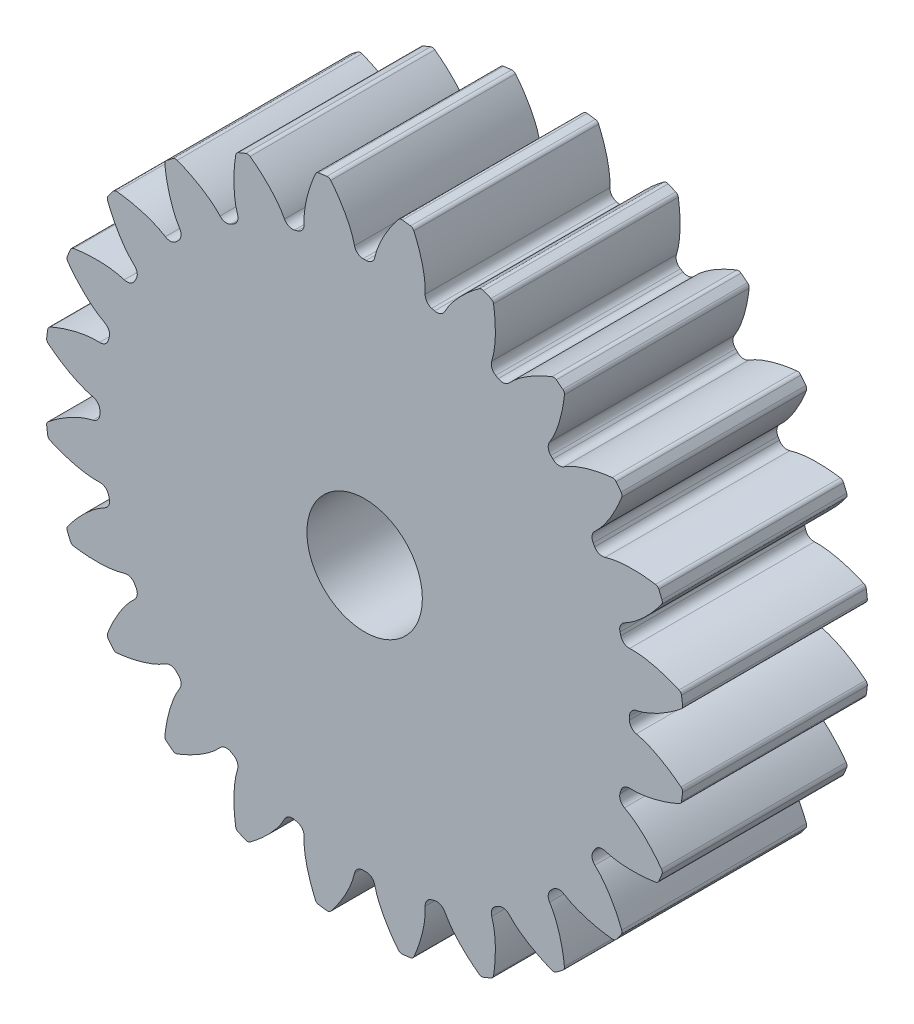
from build123d import *

# Parameters (mm, degrees)
SKETCH1_R                                 = 22.013333333
BOSS_EXTRUDE1_DEPTH                       = 12.7
CUT_EXTRUDE_DCLTBC_DEPTH                  = 34.622368877
FILLET_TIP_DCLTBC_R                       = 0.301120865
FILLET_ROOT_DCLTBC_R                      = 0.602241731
CIRPATTERN_DCLTBC_COUNT                   = 24
FILLET_TIP_DCLTBC_OF_CIRPATTERN_DCLTBC_R  = 0.301120865
FILLET_ROOT_DCLTBC_OF_CIRPATTERN_DCLTBC_R = 0.602241731
SKETCH8_R                                 = 3.96875
CUT_EXTRUDE5_DEPTH                        = 25.4


with BuildPart() as part:
    # Sketch1 → Boss-Extrude1 (new body)
    with BuildSketch(Plane.XY):
        Circle(SKETCH1_R)
    extrude(amount=BOSS_EXTRUDE1_DEPTH)

    # DCLTBC → Cut-Extrude-DCLTBC (cut, through all)
    with BuildSketch(Plane.XY):
        with BuildLine():
            Line((-0.65316759, 18.40458762), (-0.645618749, 18.191880631))
            ThreePointArc((-0.645618749, 18.191880631), (0, 18.203333333), (0.645618749, 18.191880631))
            Line((0.645618749, 18.191880631), (0.65316759, 18.40458762))
            add(Edge.make_bspline(
                [(0.65316759, 18.40458762), (0.653455488, 18.41041931), (0.654513176, 18.426763296), (0.657500609, 18.4576082), (0.663776304, 18.507831806), (0.673829279, 18.571642864), (0.68917972, 18.653865984), (0.710287754, 18.750357216), (0.736645624, 18.855957946), (0.76872217, 18.970315677), (0.803721487, 19.083890812), (0.841416112, 19.196668946), (0.881468461, 19.308519325), (0.932929894, 19.443377919), (0.998724669, 19.604184964), (1.081547695, 19.790715524), (1.182440671, 20.000496086), (1.292649071, 20.212244804), (1.407142048, 20.418866576), (1.529709249, 20.625480648), (1.653176589, 20.823856906), (1.788390425, 21.02752824), (1.916752528, 21.214328562), (2.068189061, 21.420811695), (2.192634463, 21.58664135), (2.327481485, 21.755498466), (2.394038027, 21.837316444), (2.428441227, 21.878974328)],
                knots=[0, 0, 0, 0, 0, 0.005376749, 0.015083688, 0.02853182, 0.04661014, 0.064854849, 0.092110526, 0.119476176, 0.146842496, 0.174208854, 0.201574956, 0.228941013, 0.256307345, 0.307035032, 0.361767352, 0.416499661, 0.471231937, 0.525964282, 0.580696616, 0.635428982, 0.690161387, 0.744893688, 0.799626082, 0.854358408, 0.909090915, 0.909090915, 0.909090915, 0.909090915, 0.909090915], degree=4))
            ThreePointArc((2.428441227, 21.878974328), (0, 22.013333333), (-2.428441227, 21.878974328))
            add(Edge.make_bspline(
                [(-0.65316759, 18.40458762), (-0.653455488, 18.41041931), (-0.654513176, 18.426763296), (-0.657500609, 18.4576082), (-0.663776304, 18.507831806), (-0.673829279, 18.571642864), (-0.68917972, 18.653865984), (-0.710287754, 18.750357216), (-0.736645624, 18.855957946), (-0.76872217, 18.970315677), (-0.803721487, 19.083890812), (-0.841416112, 19.196668946), (-0.881468461, 19.308519325), (-0.932929894, 19.443377919), (-0.998724669, 19.604184964), (-1.081547695, 19.790715524), (-1.182440671, 20.000496086), (-1.292649071, 20.212244804), (-1.407142048, 20.418866576), (-1.529709249, 20.625480648), (-1.653176589, 20.823856906), (-1.788390425, 21.02752824), (-1.916752528, 21.214328562), (-2.068189061, 21.420811695), (-2.192634463, 21.58664135), (-2.327481485, 21.755498466), (-2.394038027, 21.837316444), (-2.428441227, 21.878974328)],
                knots=[0, 0, 0, 0, 0, 0.005376749, 0.015083688, 0.02853182, 0.04661014, 0.064854849, 0.092110526, 0.119476176, 0.146842496, 0.174208854, 0.201574956, 0.228941013, 0.256307345, 0.307035032, 0.361767352, 0.416499661, 0.471231937, 0.525964282, 0.580696616, 0.635428982, 0.690161387, 0.744893688, 0.799626082, 0.854358408, 0.909090915, 0.909090915, 0.909090915, 0.909090915, 0.909090915], degree=4))
        make_face()
    cut_extrude_dcltbc = extrude(amount=CUT_EXTRUDE_DCLTBC_DEPTH, mode=Mode.SUBTRACT)

    # Fillet-Tip-DCLTBC
    fillet_tip_dcltbc_edges = [part.edges().sort_by_distance(p)[0] for p in [
        (2.428441227, 21.878974328, 6.35),
        (-2.428441227, 21.878974328, 6.35),
    ]]
    fillet(fillet_tip_dcltbc_edges, radius=FILLET_TIP_DCLTBC_R)

    # Fillet-Root-DCLTBC
    fillet_root_dcltbc_edges = [part.edges().sort_by_distance(p)[0] for p in [
        (-0.645618749, 18.191880631, 6.35),
        (0.645618749, 18.191880631, 6.35),
    ]]
    fillet(fillet_root_dcltbc_edges, radius=FILLET_ROOT_DCLTBC_R)

    # CirPattern-DCLTBC: Cut-Extrude-DCLTBC ×24 about axis
    cirpattern_dcltbc_axis = Axis((0, 0, 12.7), (0, 0, 1))
    for i in range(1, CIRPATTERN_DCLTBC_COUNT):
        add(cut_extrude_dcltbc.rotate(cirpattern_dcltbc_axis, i * 360 / CIRPATTERN_DCLTBC_COUNT), mode=Mode.SUBTRACT)

    # Fillet-Tip-DCLTBC of CirPattern-DCLTBC
    fillet_tip_dcltbc_of_cirpattern_dcltbc_edges = [part.edges().sort_by_distance(p)[0] for p in [
        (-3.317001145, 21.761993196, 6.35),
        (-8.008389342, 20.504939517, 6.35),
        (-8.83639537, 20.16196819, 6.35),
        (-13.042578958, 17.733526963, 6.35),
        (-13.753603853, 17.187938372, 6.35),
        (-17.187938372, 13.753603853, 6.35),
        (-17.733526963, 13.042578958, 6.35),
        (-20.16196819, 8.83639537, 6.35),
        (-20.504939517, 8.008389342, 6.35),
        (-21.761993196, 3.317001145, 6.35),
        (-21.878974328, 2.428441227, 6.35),
        (-21.878974328, -2.428441227, 6.35),
        (-21.761993196, -3.317001145, 6.35),
        (-20.504939517, -8.008389342, 6.35),
        (-20.16196819, -8.83639537, 6.35),
        (-17.733526963, -13.042578958, 6.35),
        (-17.187938372, -13.753603853, 6.35),
        (-13.753603853, -17.187938372, 6.35),
        (-13.042578958, -17.733526963, 6.35),
        (-8.83639537, -20.16196819, 6.35),
        (-8.008389342, -20.504939517, 6.35),
        (-3.317001145, -21.761993196, 6.35),
        (-2.428441227, -21.878974328, 6.35),
        (2.428441227, -21.878974328, 6.35),
        (3.317001145, -21.761993196, 6.35),
        (8.008389342, -20.504939517, 6.35),
        (8.83639537, -20.16196819, 6.35),
        (13.042578958, -17.733526963, 6.35),
        (13.753603853, -17.187938372, 6.35),
        (17.187938372, -13.753603853, 6.35),
        (17.733526963, -13.042578958, 6.35),
        (20.16196819, -8.83639537, 6.35),
        (20.504939517, -8.008389342, 6.35),
        (21.761993196, -3.317001145, 6.35),
        (21.878974328, -2.428441227, 6.35),
        (21.878974328, 2.428441227, 6.35),
        (21.761993196, 3.317001145, 6.35),
        (20.504939517, 8.008389342, 6.35),
        (20.16196819, 8.83639537, 6.35),
        (17.733526963, 13.042578958, 6.35),
        (17.187938372, 13.753603853, 6.35),
        (13.753603853, 17.187938372, 6.35),
        (13.042578958, 17.733526963, 6.35),
        (8.83639537, 20.16196819, 6.35),
        (8.008389342, 20.504939517, 6.35),
        (3.317001145, 21.761993196, 6.35),
    ]]
    fillet(fillet_tip_dcltbc_of_cirpattern_dcltbc_edges, radius=FILLET_TIP_DCLTBC_OF_CIRPATTERN_DCLTBC_R)

    # Fillet-Root-DCLTBC of CirPattern-DCLTBC
    fillet_root_dcltbc_of_cirpattern_dcltbc_edges = [part.edges().sort_by_distance(p)[0] for p in [
        (-5.332024997, 17.404908902, 6.35),
        (-4.08478535, 17.739105758, 6.35),
        (-9.655062553, 15.431821394, 6.35),
        (-8.536818077, 16.077440143, 6.35),
        (-13.320123552, 12.407080761, 6.35),
        (-12.407080761, 13.320123552, 6.35),
        (-16.077440143, 8.536818077, 6.35),
        (-15.431821394, 9.655062553, 6.35),
        (-17.739105758, 4.08478535, 6.35),
        (-17.404908902, 5.332024997, 6.35),
        (-18.191880631, -0.645618749, 6.35),
        (-18.191880631, 0.645618749, 6.35),
        (-17.404908902, -5.332024997, 6.35),
        (-17.739105758, -4.08478535, 6.35),
        (-15.431821394, -9.655062553, 6.35),
        (-16.077440143, -8.536818077, 6.35),
        (-12.407080761, -13.320123552, 6.35),
        (-13.320123552, -12.407080761, 6.35),
        (-8.536818077, -16.077440143, 6.35),
        (-9.655062553, -15.431821394, 6.35),
        (-4.08478535, -17.739105758, 6.35),
        (-5.332024997, -17.404908902, 6.35),
        (0.645618749, -18.191880631, 6.35),
        (-0.645618749, -18.191880631, 6.35),
        (5.332024997, -17.404908902, 6.35),
        (4.08478535, -17.739105758, 6.35),
        (9.655062553, -15.431821394, 6.35),
        (8.536818077, -16.077440143, 6.35),
        (13.320123552, -12.407080761, 6.35),
        (12.407080761, -13.320123552, 6.35),
        (16.077440143, -8.536818077, 6.35),
        (15.431821394, -9.655062553, 6.35),
        (17.739105758, -4.08478535, 6.35),
        (17.404908902, -5.332024997, 6.35),
        (18.191880631, 0.645618749, 6.35),
        (18.191880631, -0.645618749, 6.35),
        (17.404908902, 5.332024997, 6.35),
        (17.739105758, 4.08478535, 6.35),
        (15.431821394, 9.655062553, 6.35),
        (16.077440143, 8.536818077, 6.35),
        (12.407080761, 13.320123552, 6.35),
        (13.320123552, 12.407080761, 6.35),
        (8.536818077, 16.077440143, 6.35),
        (9.655062553, 15.431821394, 6.35),
        (4.08478535, 17.739105758, 6.35),
        (5.332024997, 17.404908902, 6.35),
    ]]
    fillet(fillet_root_dcltbc_of_cirpattern_dcltbc_edges, radius=FILLET_ROOT_DCLTBC_OF_CIRPATTERN_DCLTBC_R)

    # Sketch8 → Cut-Extrude5 (cut)
    with BuildSketch(Plane.XY):
        Circle(SKETCH8_R)
    extrude(amount=CUT_EXTRUDE5_DEPTH, mode=Mode.SUBTRACT)


solid = part.part
